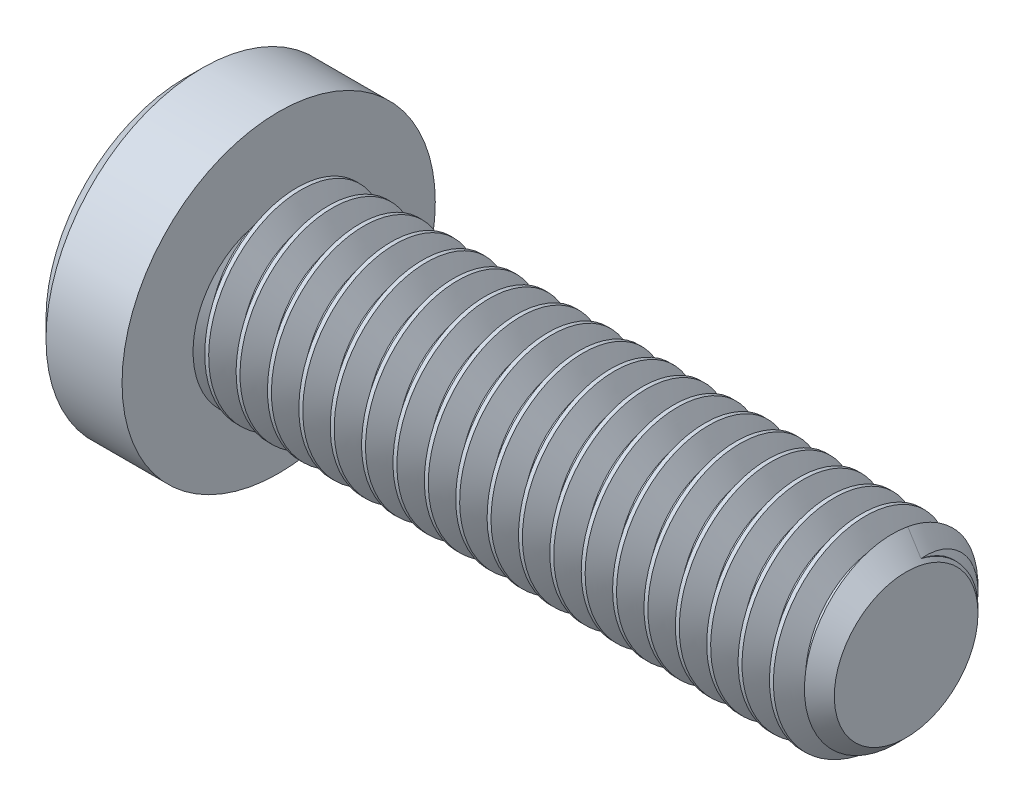
from build123d import *

# Parameters (mm, degrees)
SKETCH2_R           = 2.413
BOSS_EXTRUDE1_DEPTH = 15.875
CHAMFER1_SIZE       = 0.5953125
CUT_SWEEP1_PITCH    = 0.79375
CUT_EXTRUDE1_DEPTH  = 1.8288


with BuildPart() as part:
    # Sketch2 → Boss-Extrude1 (new body)
    with BuildSketch(Plane(origin=(7.9375, 0, 0), x_dir=(0, 0, -1), z_dir=(1, 0, 0))):
        Circle(SKETCH2_R)
    extrude(amount=-BOSS_EXTRUDE1_DEPTH)

    # Chamfer1
    chamfer1_edges = [part.edges().sort_by_distance(p)[0] for p in [
        (7.9375, 0, 2.413),
    ]]
    chamfer(chamfer1_edges, length=CHAMFER1_SIZE)

    # Cut-Sweep1: the profile of Sketch5 profile screwed along a right-hand helix of 21 turns, 8 arcs to a turn; built about Z, then put on its axis
    cut_sweep1_z = Axis((0, 0, 0), (0, 0, 1))
    cut_sweep1_corners = [(2.4133, 0, 0.34743883), (2.4133, 0, -0.34743883), (1.897444252, 0, -0.049609375), (1.897444252, 0, 0.049609375)]
    with BuildLine(mode=Mode.PRIVATE) as cut_sweep1_profile:
        Line(cut_sweep1_corners[0], cut_sweep1_corners[1])
        Line(cut_sweep1_corners[1], cut_sweep1_corners[2])
        Line(cut_sweep1_corners[2], cut_sweep1_corners[3])
        Line(cut_sweep1_corners[3], cut_sweep1_corners[0])
    cut_sweep1_cap = Face(cut_sweep1_profile.wire())
    cut_sweep1_turn_angles = [0, 22.5, 45, 67.5, 90, 112.5, 135, 157.5, 180, 202.5, 225, 247.5, 270, 292.5, 315, 337.5, 360]
    cut_sweep1_turn_weights = [1, 0.9238795325112867, 1, 0.9238795325112867, 1, 0.9238795325112867, 1, 0.9238795325112867, 1, 0.9238795325112867, 1, 0.9238795325112867, 1, 0.9238795325112867, 1, 0.9238795325112867, 1]
    cut_sweep1_turn_rails = [Edge.make_bspline([Vector(p[0], p[1], 0).rotate(cut_sweep1_z, cut_sweep1_turn_angles[k]) / cut_sweep1_turn_weights[k] + Vector(0, 0, p[2] + CUT_SWEEP1_PITCH * cut_sweep1_turn_angles[k] / 360) for k in range(17)], [0, 0, 0, 1, 1, 2, 2, 3, 3, 4, 4, 5, 5, 6, 6, 7, 7, 8, 8, 8], 2, cut_sweep1_turn_weights) for p in cut_sweep1_corners]
    cut_sweep1_turn_sides = [Face.make_surface_from_curves(cut_sweep1_turn_rails[p[0]], cut_sweep1_turn_rails[p[1]]) for p in [(0, 1), (1, 2), (2, 3), (3, 0)]]
    cut_sweep1 = Plane(origin=(7.9375, 0, 0), x_dir=(0, 1, 0), z_dir=(-1, 0, 0)) * Solid(Shell([*[p.moved(Location((0, 0, CUT_SWEEP1_PITCH * i))) for i in range(21) for p in cut_sweep1_turn_sides], cut_sweep1_cap, cut_sweep1_cap.rotate(cut_sweep1_z, 7560).moved(Location((0, 0, CUT_SWEEP1_PITCH * 7560 / 360)))]))
    add(cut_sweep1, mode=Mode.SUBTRACT)

    # Sketch6 → Revolve1 (revolve)
    with BuildSketch(Plane.XY, mode=Mode.PRIVATE) as revolve1_sk:
        Polygon((-9.86155, 3.9624), (-10.31875, 3.5052), (-10.31875, 0), (-7.9375, 0), (-7.9375, 3.9624), align=None)
    revolve(revolve1_sk.sketch.rotate(Axis((-7.9375, 0, 0), (-1, 0, 0)), 13.865622854), axis=Axis((-7.9375, 0, 0), (-1, 0, 0)))

    # Sketch4 → Cut-Extrude1 (cut)
    with BuildSketch(Plane(origin=(-10.31875, 0, 0), x_dir=(0, 0, -1), z_dir=(1, 0, 0))):
        Polygon((0, 1.374815329), (-1.190625, 0.687407664), (-1.190625, -0.687407664), (0, -1.374815329), (1.190625, -0.687407664), (1.190625, 0.687407664), align=None)
    extrude(amount=CUT_EXTRUDE1_DEPTH, mode=Mode.SUBTRACT)

    # Cut-Extrude2 cone 1 section (through the dimple's axis) → Cut-Extrude2 (revolve, cut)
    with BuildSketch(Plane(origin=(-10.31875, 0, 0), x_dir=(0, 0, 1), z_dir=(0, 1, 0))):
        Polygon((0, 0), (1.374815329, 0), (0, 1.374815329), align=None)
    revolve(axis=Axis((-10.31875, 0, 0), (1, 0, 0)), mode=Mode.SUBTRACT)


solid = part.part
